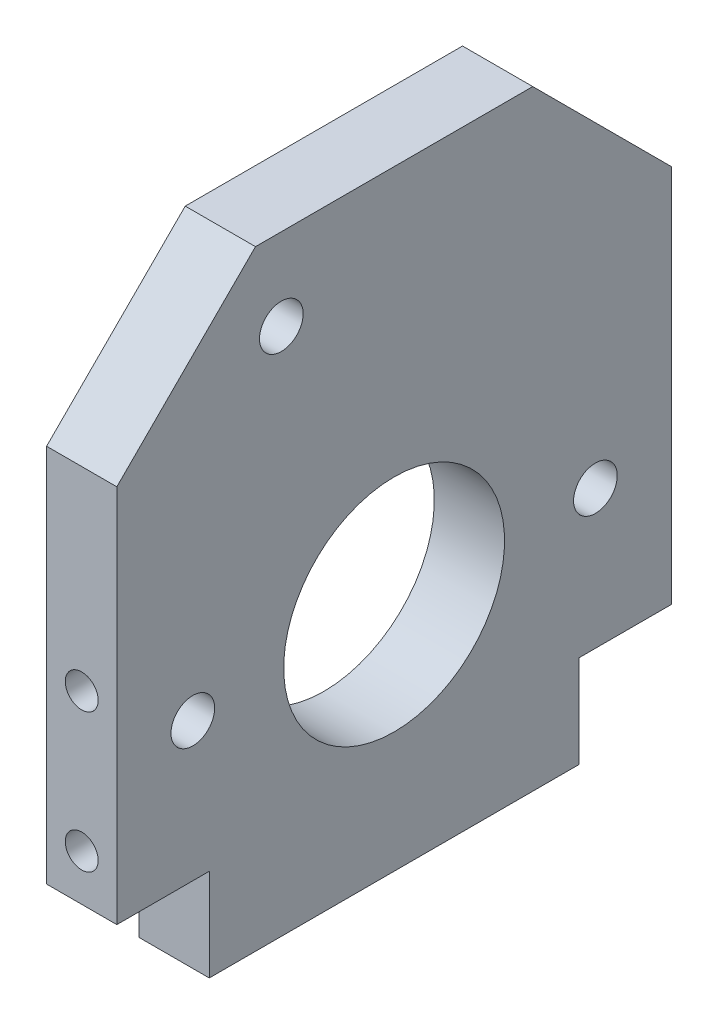
from build123d import *

# Parameters (mm, degrees)
SKETCH1_R                 = 7.5875
BOSS_EXTRUDE1_DEPTH       = 4.826
F_3_0_3_DIAMETER_HOLE1_D  = 3
CHAMFER1_SIZE             = 9.525
F_4_40_TAPPED_HOLE1_D     = 2.2606
F_4_40_TAPPED_HOLE1_DEPTH = 7.62
F_4_40_TAPPED_HOLE1_TIP   = 0.679152758
F_4_40_TAPPED_HOLE2_D     = 2.2606
F_4_40_TAPPED_HOLE2_DEPTH = 7.62
F_4_40_TAPPED_HOLE2_TIP   = 0.679152758


with BuildPart() as part:
    # Sketch1 → Boss-Extrude1 (new body)
    with BuildSketch(Plane(origin=(0, 0, 0), x_dir=(0, 0, -1), z_dir=(1, 0, 0))):
        Polygon((-14.79708996, 30.282346416), (23.30291004, 30.282346416), (23.30291004, -5.292653584), (16.95291004, -5.292653584), (16.95291004, -11.642653584), (-8.44708996, -11.642653584), (-8.44708996, -5.292653584), (-14.79708996, -5.292653584), align=None)
        with Locations((4.25291004, 4.232346416)):
            Circle(SKETCH1_R, mode=Mode.SUBTRACT)
    extrude(amount=BOSS_EXTRUDE1_DEPTH)

    # Ø3.0 (3) Diameter Hole1 (through all)
    with Locations(Plane.ZY):
        with Locations((3.49708996, 24.655740175), (9.576406646, 4.232346416), (-18.082226726, 4.232346416)):
            Hole(F_3_0_3_DIAMETER_HOLE1_D / 2)

    # Chamfer1
    chamfer1_edges = [part.edges().sort_by_distance(p)[0] for p in [
        (2.413, 30.282346416, -23.30291004),
        (2.413, 30.282346416, 14.79708996),
    ]]
    chamfer(chamfer1_edges, length=CHAMFER1_SIZE)

    # #4-40 Tapped Hole1
    with Locations(Plane(origin=(-40.959349893, -24.044697485, -23.30291004), x_dir=(-1, 0, 0), z_dir=(0, 0, -1))):
        with Locations((-43.372349893, 31.452043901), (-43.372349893, 21.927043901)):
            Hole(F_4_40_TAPPED_HOLE1_D / 2, depth=F_4_40_TAPPED_HOLE1_DEPTH)
            with Locations((0, 0, -(F_4_40_TAPPED_HOLE1_DEPTH + F_4_40_TAPPED_HOLE1_TIP / 2))):  # 118° drill point
                Cone(0, F_4_40_TAPPED_HOLE1_D / 2, F_4_40_TAPPED_HOLE1_TIP, mode=Mode.SUBTRACT)

    # #4-40 Tapped Hole2
    with Locations(Plane(origin=(-40.959349893, -24.044697485, 14.79708996), x_dir=(1, 0, 0), z_dir=(0, 0, 1))):
        with Locations((43.372349893, 21.927043901), (43.372349893, 31.452043901)):
            Hole(F_4_40_TAPPED_HOLE2_D / 2, depth=F_4_40_TAPPED_HOLE2_DEPTH)
            with Locations((0, 0, -(F_4_40_TAPPED_HOLE2_DEPTH + F_4_40_TAPPED_HOLE2_TIP / 2))):  # 118° drill point
                Cone(0, F_4_40_TAPPED_HOLE2_D / 2, F_4_40_TAPPED_HOLE2_TIP, mode=Mode.SUBTRACT)


solid = part.part
